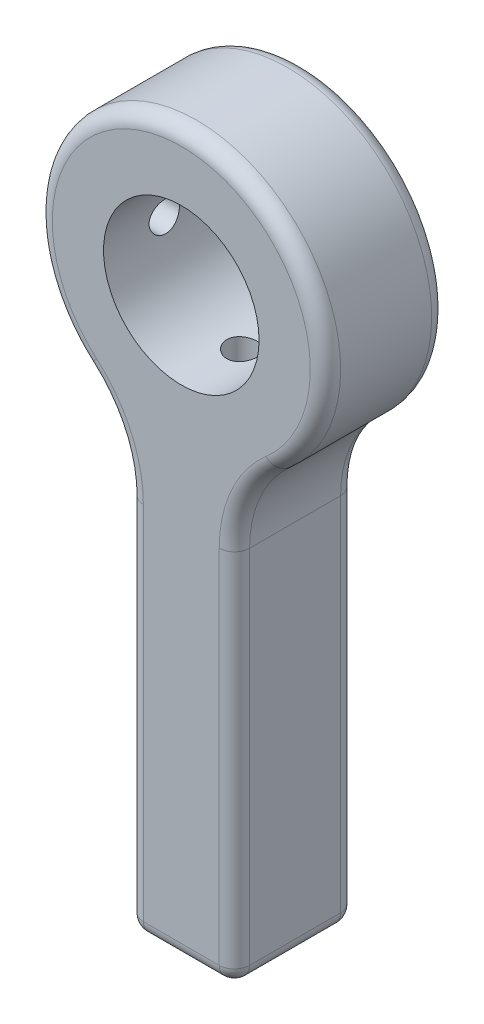
from build123d import *

# Parameters (mm, degrees)
SKETCH2_R           = 5.125
BOSS_EXTRUDE1_DEPTH = 8
SKETCH3_R           = 1
CUT_EXTRUDE1_DEPTH  = 40.978119015
CUT_EXTRUDE2_START  = -9.5
SKETCH5_R           = 2.375
CUT_EXTRUDE2_DEPTH  = 88
SKETCH6_R           = 1
CUT_EXTRUDE3_DEPTH  = 40.978119035
FILLET2_R           = 8
FILLET1_R           = 1


with BuildPart() as part:
    # Sketch2 → Boss-Extrude1 (new body)
    with BuildSketch(Plane.XY):
        with BuildLine():
            Line((0, -38), (3.5, -38))
            Line((3.5, -38), (3.5, -8.831760866))
            ThreePointArc((3.5, -8.831760866), (0, 9.5), (-3.5, -8.831760866))
            Line((-3.5, -8.831760866), (-3.5, -38))
            Line((-3.5, -38), (0, -38))
        make_face()
        Circle(SKETCH2_R, mode=Mode.SUBTRACT)
    extrude(amount=BOSS_EXTRUDE1_DEPTH)

    # Sketch3 → Cut-Extrude1 (cut, through all)
    with BuildSketch(Plane(origin=(0, 0, 0), x_dir=(1, 0, 0), z_dir=(0, 1, 0))):
        with Locations((0, -4)):
            Circle(SKETCH3_R)
    extrude(amount=-CUT_EXTRUDE1_DEPTH, mode=Mode.SUBTRACT)

    # Sketch5 → Cut-Extrude2 (cut)
    with BuildSketch(Plane(origin=(0, 0, 0), x_dir=(1, 0, 0), z_dir=(0, 1, 0)).offset(CUT_EXTRUDE2_START)):
        with Locations((0, -4)):
            Circle(SKETCH5_R)
    extrude(amount=-CUT_EXTRUDE2_DEPTH, mode=Mode.SUBTRACT)

    # Sketch6 → Cut-Extrude3 (cut, through all)
    with BuildSketch(Plane(origin=(0, 0, 0), x_dir=(0, 0, -1), z_dir=(1, 0, 0))):
        with Locations((-4, 0)):
            Circle(SKETCH6_R)
    extrude(amount=-CUT_EXTRUDE3_DEPTH, mode=Mode.SUBTRACT)

    # Fillet2
    fillet2_edges = [part.edges().sort_by_distance(p)[0] for p in [
        (3.5, -8.831760866, 4),
        (-3.5, -8.831760866, 4),
    ]]
    fillet(fillet2_edges, radius=FILLET2_R)

    # Fillet1
    fillet1_edges = [part.edges().sort_by_distance(p)[0] for p in [
        (-3.5, -25.595452979, 0),
        (0, -38, 0),
        (3.5, -25.595452979, 0),
        (0, 9.5, 0),
        (3.5, -25.595452979, 8),
        (0, -38, 8),
        (-3.5, -25.595452979, 8),
        (0, 9.5, 8),
        (3.5, -38, 4),
        (-3.5, -38, 4),
        (-4.217928081, -9.878591273, 0),
        (4.217928081, -9.878591273, 0),
        (-4.217928081, -9.878591273, 8),
        (4.217928081, -9.878591273, 8),
    ]]
    fillet(fillet1_edges, radius=FILLET1_R)


solid = part.part
